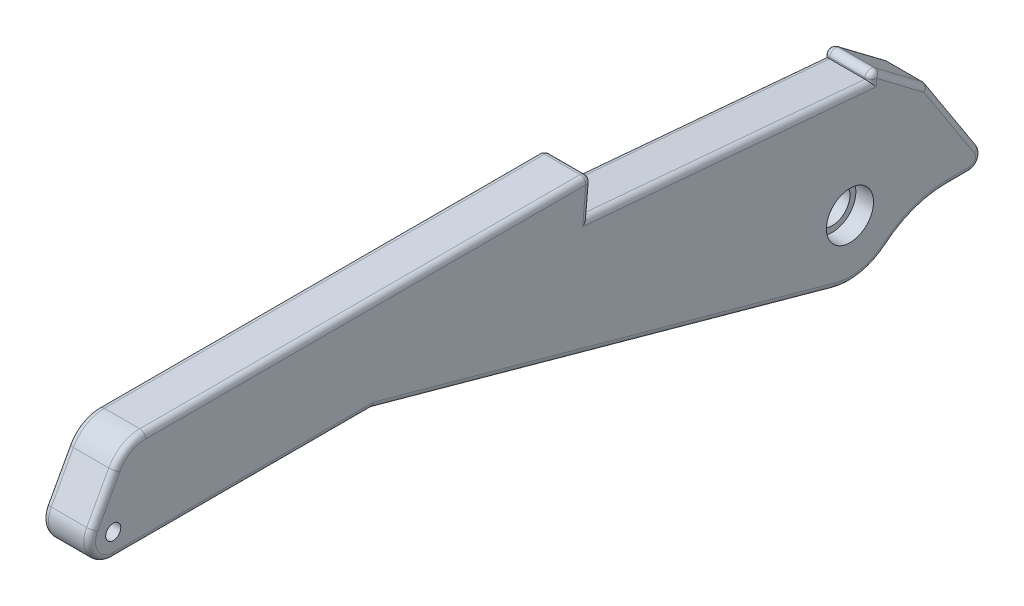
from build123d import *

# Parameters (mm, degrees)
SKETCH1_R           = 2.032
BOSS_EXTRUDE1_DEPTH = 12.7
FILLET1_R           = 9.525
SKETCH2_R           = 4.7625
CUT_EXTRUDE1_DEPTH  = 238.90790865
SKETCH4_R           = 6.35
CUT_EXTRUDE2_DEPTH  = 4.7625
FILLET2_R           = 1.5875


with BuildPart() as part:
    # Sketch1 → Boss-Extrude1 (new body)
    with BuildSketch(Plane(origin=(0, 0, 0), x_dir=(0, 0, -1), z_dir=(1, 0, 0))):
        with BuildLine():
            Line((-5.574599012, 3.040780467), (3.088839194, 18.923279907))
            Line((3.088839194, 18.923279907), (129.054233098, 18.923279907))
            Line((129.054233098, 18.923279907), (128.224074649, 9.434525408))
            Line((128.224074649, 9.434525408), (204.134110643, 2.79325781))
            Line((204.134110643, 2.79325781), (204.161005679, 3.100669472))
            ThreePointArc((204.161005679, 3.100669472), (205.09730431, 4.412800765), (206.698779384, 4.229439793))
            Line((206.698779384, 4.229439793), (219.392961654, -5.350975413))
            ThreePointArc((219.392961654, -5.350975413), (219.598467913, -5.536288257), (219.768672831, -5.75447157))
            Line((219.768672831, -5.75447157), (233.444725546, -26.84773219))
            ThreePointArc((233.444725546, -26.84773219), (233.570360338, -30.091006218), (230.780673949, -31.75))
            Line((230.780673949, -31.75), (224.896696771, -31.75))
            ThreePointArc((224.896696771, -31.75), (216.268745771, -33.260285445), (208.666831685, -37.611538462))
            ThreePointArc((208.666831685, -37.611538462), (201.862183679, -40.919877125), (194.299038193, -40.702691568))
            Line((194.299038193, -40.702691568), (69.85, -6.35))
            Line((69.85, -6.35), (0, -6.35))
            ThreePointArc((0, -6.35), (-5.460378007, -3.241415126), (-5.574599012, 3.040780467))
        make_face()
        Circle(SKETCH1_R, mode=Mode.SUBTRACT)
    extrude(amount=BOSS_EXTRUDE1_DEPTH)

    # Fillet1
    fillet1_edges = [part.edges().sort_by_distance(p)[0] for p in [
        (6.35, 18.923279907, -3.088839194),
    ]]
    fillet(fillet1_edges, radius=FILLET1_R)

    # Sketch2 → Cut-Extrude1 (cut, through all)
    with BuildSketch(Plane.ZY):
        with Locations((-198.523166007, -25.4)):
            Circle(SKETCH2_R)
    extrude(amount=-CUT_EXTRUDE1_DEPTH, mode=Mode.SUBTRACT)

    # Sketch4 → Cut-Extrude2 (cut)
    with BuildSketch(Plane(origin=(12.7, 0, 0), x_dir=(0, 0, -1), z_dir=(1, 0, 0))):
        with Locations((198.523166007, -25.4)):
            Circle(SKETCH4_R)
    extrude(amount=-CUT_EXTRUDE2_DEPTH, mode=Mode.SUBTRACT)

    # Fillet2
    fillet2_edges = [part.edges().sort_by_distance(p)[0] for p in [
        (0, 2.946963641, -204.147558161),
        (0, 4.412800765, -205.09730431),
        (0, -0.56076781, -213.045870519),
        (0, -5.536288257, -219.598467913),
        (0, -16.30110188, -226.606699189),
        (0, -30.091006218, -233.570360338),
        (0, -31.75, -227.83868536),
        (0, -33.260285445, -216.268745771),
        (0, -40.919877125, -201.862183679),
        (0, -6.35, -34.925),
        (0, -3.241415126, 5.460378007),
        (0, 8.500115538, 2.596691649),
        (0, 17.588846918, -3.880991544),
        (12.7, 2.946963641, -204.147558161),
        (12.7, 4.412800765, -205.09730431),
        (12.7, -0.56076781, -213.045870519),
        (12.7, -5.536288257, -219.598467913),
        (12.7, -16.30110188, -226.606699189),
        (12.7, -30.091006218, -233.570360338),
        (12.7, -31.75, -227.83868536),
        (12.7, -33.260285445, -216.268745771),
        (12.7, -40.919877125, -201.862183679),
        (12.7, -6.35, -34.925),
        (12.7, -3.241415126, 5.460378007),
        (12.7, 8.500115538, 2.596691649),
        (12.7, 17.588846918, -3.880991544),
        (0, -23.526345784, -132.074519097),
        (0, 6.113891609, -166.179092646),
        (0, 14.178902657, -128.639153874),
        (0, 18.923279907, -68.898673666),
        (12.7, -23.526345784, -132.074519097),
        (12.7, 6.113891609, -166.179092646),
        (12.7, 14.178902657, -128.639153874),
        (6.35, 18.923279907, -129.054233098),
        (12.7, 18.923279907, -68.898673666),
    ]]
    fillet(fillet2_edges, radius=FILLET2_R)


solid = part.part
